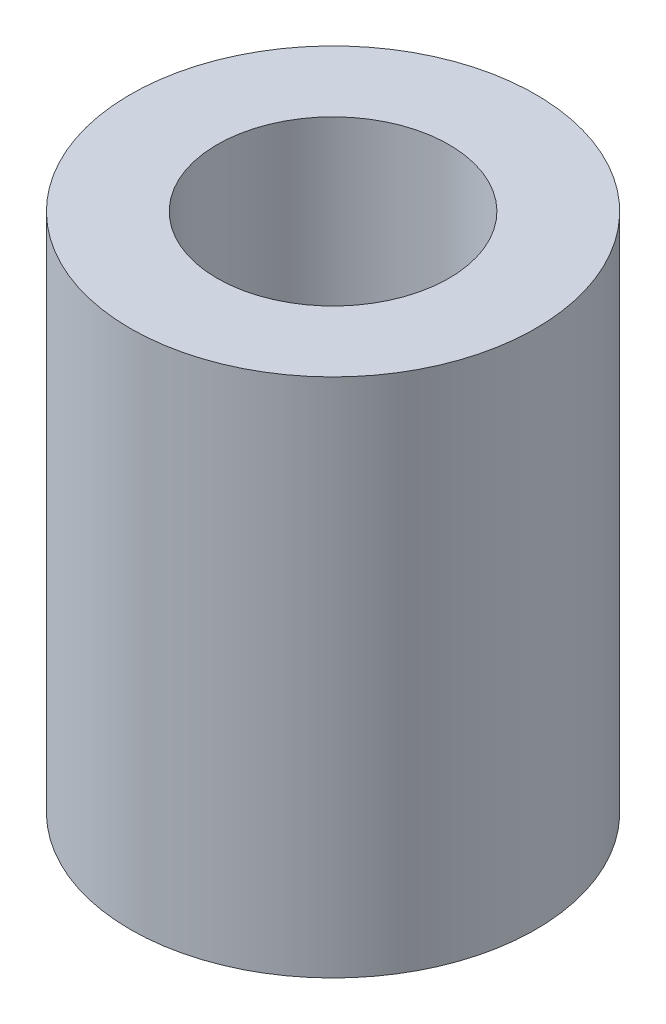
from build123d import *

# Parameters (mm, degrees)
SKETCH2_R           = 5.335
SKETCH2_R_2         = 3.05
BOSS_EXTRUDE1_DEPTH = 13.7


with BuildPart() as part:
    # Sketch2 → Boss-Extrude1 (new body)
    with BuildSketch(Plane(origin=(0, 0, 0), x_dir=(1, 0, 0), z_dir=(0, 1, 0))):
        Circle(SKETCH2_R)
        Circle(SKETCH2_R_2, mode=Mode.SUBTRACT)
    extrude(amount=BOSS_EXTRUDE1_DEPTH)


solid = part.part
